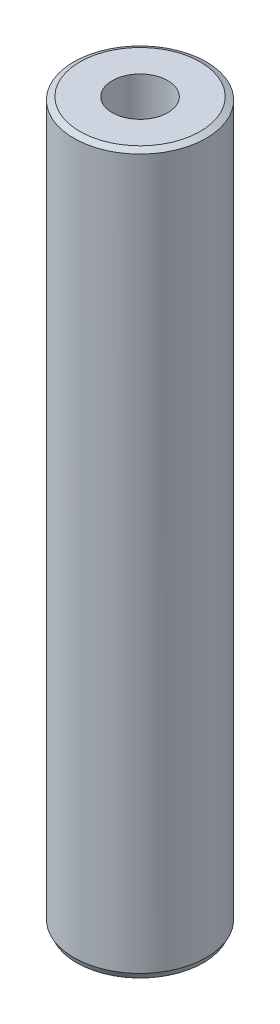
from build123d import *
from OCP.BRepFilletAPI import BRepFilletAPI_MakeChamfer

# Parameters (mm, degrees)
SKETCH1_R           = 5
BOSS_EXTRUDE1_DEPTH = 54.233803948
SKETCH2_R           = 2.098856482
CUT_EXTRUDE1_DEPTH  = 55.692828512
CHAMFER1_SIZE       = 0.220826848
CHAMFER1_SIZE2      = 0.45402603


with BuildPart() as part:
    # Sketch1 → Boss-Extrude1 (new body)
    with BuildSketch(Plane(origin=(0, 0, 0), x_dir=(1, 0, 0), z_dir=(0, 1, 0))):
        Circle(SKETCH1_R)
    extrude(amount=BOSS_EXTRUDE1_DEPTH)

    # Sketch2 → Cut-Extrude1 (cut, through all)
    with BuildSketch(Plane(origin=(0, 0, 0), x_dir=(1, 0, 0), z_dir=(0, 1, 0))):
        Circle(SKETCH2_R)
    extrude(amount=CUT_EXTRUDE1_DEPTH, mode=Mode.SUBTRACT)

    # Chamfer1: one chamfer whose edges measure the first distance from different faces: ONE call of the kernel's chamfer builder (chamfer() names one face for all edges)
    chamfer1_edges_1 = [part.edges().sort_by_distance(p)[0] for p in [
        (-5, 54.233803948, 0),
    ]]
    chamfer1_side_1 = [part.faces().sort_by_distance(p)[0] for p in [
        (-5, 27.116901974, 0),
    ]]
    chamfer1_edges_2 = [part.edges().sort_by_distance(p)[0] for p in [
        (-5, 0, 0),
    ]]
    chamfer1_side_2 = [part.faces().sort_by_distance(p)[0] for p in [
        (-4.858578644, 0, 0),
    ]]
    chamfer1 = BRepFilletAPI_MakeChamfer(part.part.solid().wrapped)
    for e in chamfer1_edges_1:
        chamfer1.Add(CHAMFER1_SIZE, CHAMFER1_SIZE2, e.wrapped, chamfer1_side_1[0].wrapped)  # the first distance lies on this face
    for e in chamfer1_edges_2:
        chamfer1.Add(CHAMFER1_SIZE, CHAMFER1_SIZE2, e.wrapped, chamfer1_side_2[0].wrapped)  # the first distance lies on this face
    add(Compound.cast(chamfer1.Shape()), mode=Mode.REPLACE)


solid = part.part
